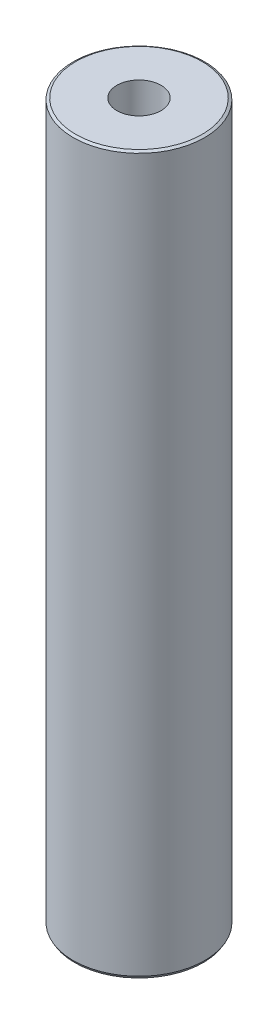
from build123d import *
from OCP.BRepFilletAPI import BRepFilletAPI_MakeChamfer

# Parameters (mm, degrees)
SKETCH1_R           = 47.5
BOSS_EXTRUDE1_DEPTH = 517.919963905
SKETCH2_R           = 15.945022716
CUT_EXTRUDE1_DEPTH  = 523.258163183
CHAMFER1_SIZE       = 1.073596268
CHAMFER1_SIZE2      = 1.859523283


with BuildPart() as part:
    # Sketch1 → Boss-Extrude1 (new body)
    with BuildSketch(Plane(origin=(0, 0, 0), x_dir=(1, 0, 0), z_dir=(0, 1, 0))):
        Circle(SKETCH1_R)
    extrude(amount=BOSS_EXTRUDE1_DEPTH)

    # Sketch2 → Cut-Extrude1 (cut, through all)
    with BuildSketch(Plane(origin=(0, 0, 0), x_dir=(1, 0, 0), z_dir=(0, 1, 0))):
        Circle(SKETCH2_R)
    extrude(amount=CUT_EXTRUDE1_DEPTH, mode=Mode.SUBTRACT)

    # Chamfer1: one chamfer whose edges measure the first distance from different faces: ONE call of the kernel's chamfer builder (chamfer() names one face for all edges)
    chamfer1_edges_1 = [part.edges().sort_by_distance(p)[0] for p in [
        (-47.5, 517.919963905, 0),
    ]]
    chamfer1_side_1 = [part.faces().sort_by_distance(p)[0] for p in [
        (-47.5, 258.959981952, 0),
    ]]
    chamfer1_edges_2 = [part.edges().sort_by_distance(p)[0] for p in [
        (-47.5, 0, 0),
    ]]
    chamfer1_side_2 = [part.faces().sort_by_distance(p)[0] for p in [
        (-46.156497116, 0, 0),
    ]]
    chamfer1 = BRepFilletAPI_MakeChamfer(part.part.solid().wrapped)
    for e in chamfer1_edges_1:
        chamfer1.Add(CHAMFER1_SIZE, CHAMFER1_SIZE2, e.wrapped, chamfer1_side_1[0].wrapped)  # the first distance lies on this face
    for e in chamfer1_edges_2:
        chamfer1.Add(CHAMFER1_SIZE, CHAMFER1_SIZE2, e.wrapped, chamfer1_side_2[0].wrapped)  # the first distance lies on this face
    add(Compound.cast(chamfer1.Shape()), mode=Mode.REPLACE)


solid = part.part
